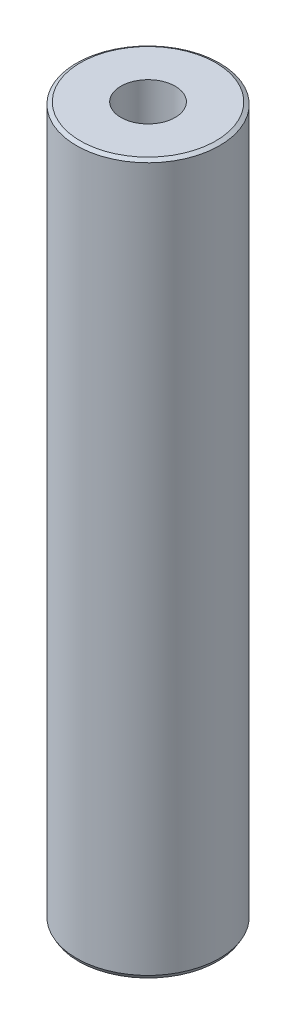
from build123d import *
from OCP.BRepFilletAPI import BRepFilletAPI_MakeChamfer

# Parameters (mm, degrees)
SKETCH1_R           = 37.5
BOSS_EXTRUDE1_DEPTH = 371.956406027
SKETCH2_R           = 14.229483172
CUT_EXTRUDE1_DEPTH  = 376.718069814
CHAMFER1_SIZE       = 1.157035535
CHAMFER1_SIZE2      = 2.004044333


with BuildPart() as part:
    # Sketch1 → Boss-Extrude1 (new body)
    with BuildSketch(Plane(origin=(0, 0, 0), x_dir=(1, 0, 0), z_dir=(0, 1, 0))):
        Circle(SKETCH1_R)
    extrude(amount=BOSS_EXTRUDE1_DEPTH)

    # Sketch2 → Cut-Extrude1 (cut, through all)
    with BuildSketch(Plane(origin=(0, 0, 0), x_dir=(1, 0, 0), z_dir=(0, 1, 0))):
        Circle(SKETCH2_R)
    extrude(amount=CUT_EXTRUDE1_DEPTH, mode=Mode.SUBTRACT)

    # Chamfer1: one chamfer whose edges measure the first distance from different faces: ONE call of the kernel's chamfer builder (chamfer() names one face for all edges)
    chamfer1_edges_1 = [part.edges().sort_by_distance(p)[0] for p in [
        (-37.5, 371.956406027, 0),
    ]]
    chamfer1_side_1 = [part.faces().sort_by_distance(p)[0] for p in [
        (-37.5, 185.978203014, 0),
    ]]
    chamfer1_edges_2 = [part.edges().sort_by_distance(p)[0] for p in [
        (-37.5, 0, 0),
    ]]
    chamfer1_side_2 = [part.faces().sort_by_distance(p)[0] for p in [
        (-36.439339828, 0, 0),
    ]]
    chamfer1 = BRepFilletAPI_MakeChamfer(part.part.solid().wrapped)
    for e in chamfer1_edges_1:
        chamfer1.Add(CHAMFER1_SIZE, CHAMFER1_SIZE2, e.wrapped, chamfer1_side_1[0].wrapped)  # the first distance lies on this face
    for e in chamfer1_edges_2:
        chamfer1.Add(CHAMFER1_SIZE, CHAMFER1_SIZE2, e.wrapped, chamfer1_side_2[0].wrapped)  # the first distance lies on this face
    add(Compound.cast(chamfer1.Shape()), mode=Mode.REPLACE)


solid = part.part
